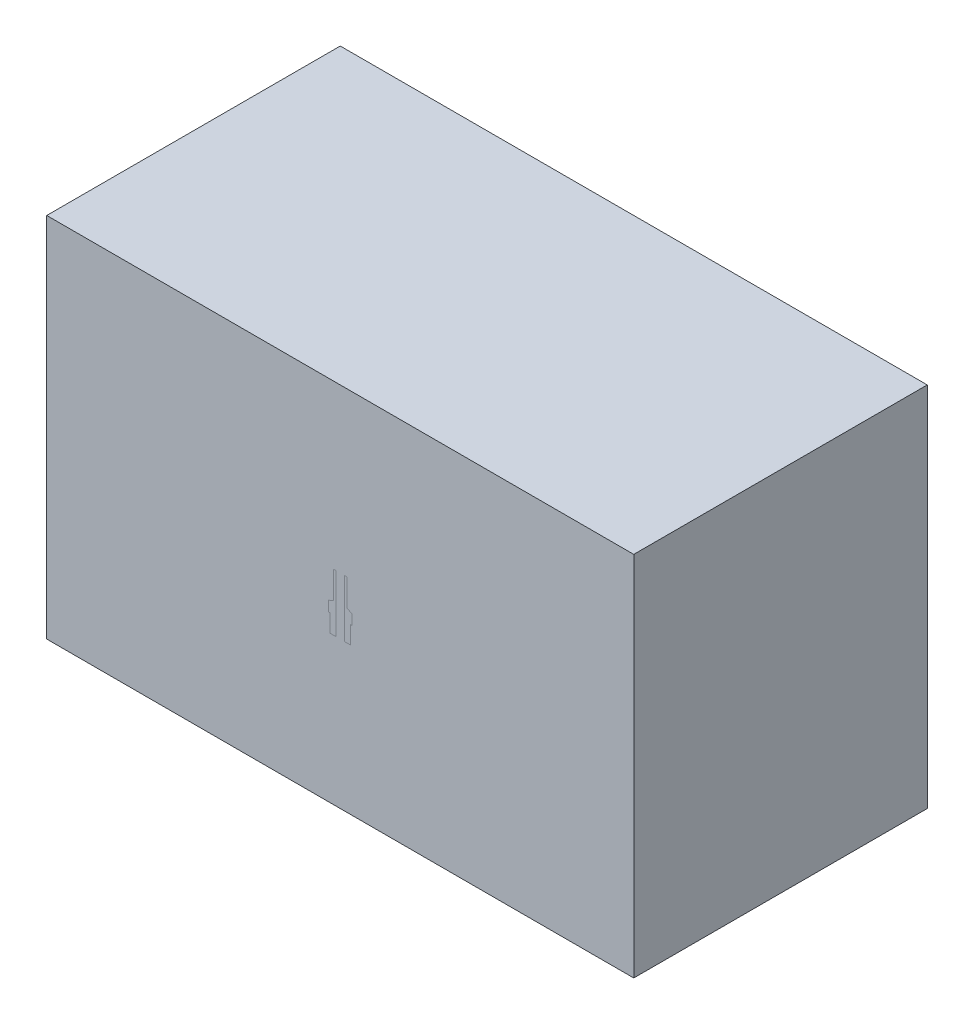
from build123d import *

# Parameters (mm, degrees)
SKETCH1_R           = 175
SKETCH1_R_2         = 75
BOSS_EXTRUDE1_DEPTH = 457
SKETCH3_W           = 10160
SKETCH3_H           = 6350
BOSS_EXTRUDE2_DEPTH = 5080
SKETCH4_W           = 13475.768327993
SKETCH4_H           = 8367.586519284
CUT_EXTRUDE1_DEPTH  = 8132.96778154


# Read off the part's stored shape, not the designer's step: Intersect1
with BuildPart() as part:
    # Sketch1 → Boss-Extrude1 (new body)
    with BuildSketch(Plane(origin=(0, 0, 0), x_dir=(1, 0, 0), z_dir=(0, 1, 0))):
        with Locations(Location((0, 0, 0), (0, 0, 270))):
            Circle(SKETCH1_R)
        with Locations(Location((0, 0, 0), (0, 0, 270))):
            Circle(SKETCH1_R_2, mode=Mode.SUBTRACT)
    extrude(amount=BOSS_EXTRUDE1_DEPTH)

    # Sketch2 → Revolve1 (revolve)
    with BuildSketch(Plane.XY, mode=Mode.PRIVATE) as revolve1_sk:
        Polygon((-175, 307), (-200.4, 307), (-200.4, 482.4), (-113.1, 523.108658557), (-113.1, 990.4), (-75, 990.4), (-75, 533.2), (-75, 457), (-175, 457), align=None)
    revolve(revolve1_sk.sketch.rotate(Axis((0, 0, 0), (0, 1, 0)), 270), axis=Axis((0, 0, 0), (0, 1, 0)))


with BuildPart() as body_2:
    # Sketch3 → Boss-Extrude2 (new, symmetric)
    with BuildSketch(Plane(origin=(0, 0, 0), x_dir=(0, 0, -1), z_dir=(1, 0, 0))):
        with Locations((0, 635)):
            Rectangle(SKETCH3_W, SKETCH3_H)
    extrude(amount=BOSS_EXTRUDE2_DEPTH, both=True)

    # Intersect1 outline → Intersect1 (revolve, cut)
    with BuildSketch(Plane.XY):
        Polygon((113.1, 990.4), (75, 990.4), (75, 0), (175, 0), (175, 307), (200.4, 307), (200.4, 482.4), (113.1, 523.108658557), align=None)
    revolve(axis=Axis((0, 0, 0), (0, 1, 0)), mode=Mode.SUBTRACT)


with BuildPart() as cut_extrude1_tool:
    # Sketch4 → Cut-Extrude1 (new, through all)
    with BuildSketch(Plane.XY):
        with Locations((454.179344916, 464.014834855)):
            Rectangle(SKETCH4_W, SKETCH4_H)
    extrude(amount=CUT_EXTRUDE1_DEPTH)


with BuildPart() as part_1:
    add(part.part)

    # Cut-Extrude1: cut by cut_extrude1_tool
    add(cut_extrude1_tool.part, mode=Mode.SUBTRACT)


with BuildPart() as body_2_1:
    add(body_2.part)

    # Cut-Extrude1: cut by cut_extrude1_tool
    add(cut_extrude1_tool.part, mode=Mode.SUBTRACT)


solid = Compound([part_1.part, body_2_1.part])
